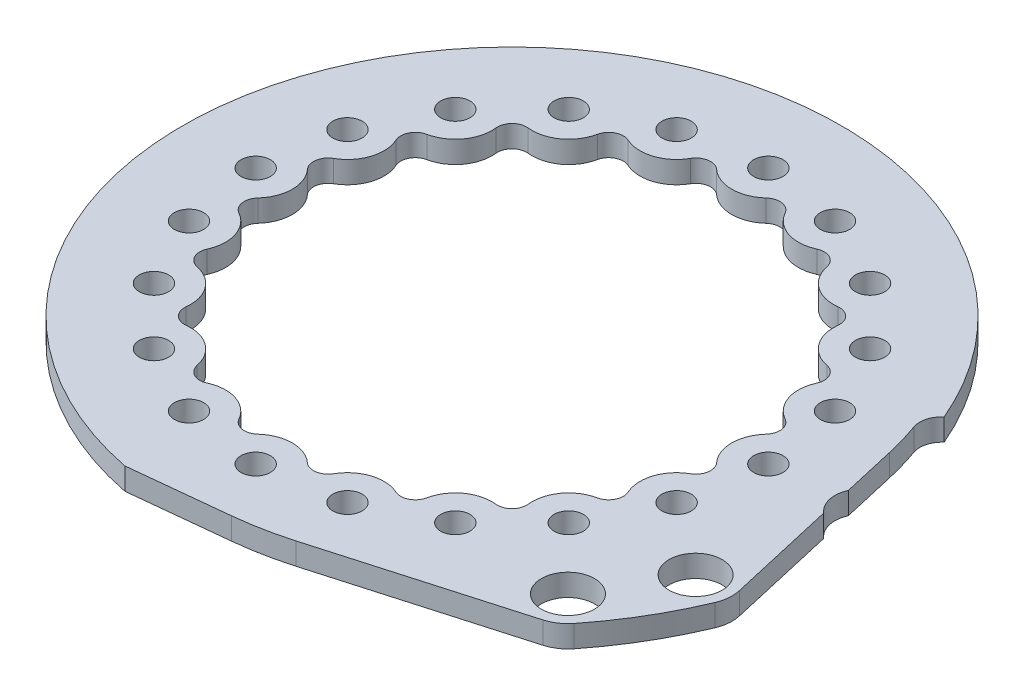
from build123d import *

# Parameters (mm, degrees)
SKETCH1_R           = 103.5
SKETCH1_R_2         = 60
BOSS_EXTRUDE1_DEPTH = 6
SKETCH2_R           = 4
CUT_EXTRUDE1_DEPTH  = 147.494027182
CIRPATTERN1_COUNT   = 20
SKETCH3_R           = 7.25
CUT_EXTRUDE2_DEPTH  = 6
SKETCH4_OUTSIDE_W   = 267.56
SKETCH4_OUTSIDE_H   = 267.56
CUT_EXTRUDE3_DEPTH  = 147.494027182
CUT_EXTRUDE4_DEPTH  = 10
BOSS_EXTRUDE2_START = -6
BOSS_EXTRUDE2_DEPTH = 6
FILLET1_R           = 6
SKETCH7_R           = 7.5
CUT_EXTRUDE5_DEPTH  = 10


with BuildPart() as part:
    # Sketch1 → Boss-Extrude1 (new body)
    with BuildSketch(Plane(origin=(0, 0, 0), x_dir=(1, 0, 0), z_dir=(0, 1, 0))):
        with Locations(Location((0, 0, 0), (0, 0, 270))):
            Circle(SKETCH1_R)
        with Locations(Location((0, 0, 0), (0, 0, 270))):
            Circle(SKETCH1_R_2, mode=Mode.SUBTRACT)
    extrude(amount=BOSS_EXTRUDE1_DEPTH)

    # Sketch2 → Cut-Extrude1 (cut, through all)
    with BuildSketch(Plane(origin=(0, 6, 0), x_dir=(1, 0, 0), z_dir=(0, 1, 0))):
        with Locations(Location((0, 70, 0), (0, 0, 270))):
            Circle(SKETCH2_R)
    cut_extrude1 = extrude(amount=-CUT_EXTRUDE1_DEPTH, mode=Mode.SUBTRACT)

    # CirPattern1: Cut-Extrude1 ×20 about axis
    cirpattern1_axis = Axis((0, 0, 0), (0, 1, 0))
    for i in range(1, CIRPATTERN1_COUNT):
        add(cut_extrude1.rotate(cirpattern1_axis, i * 360 / CIRPATTERN1_COUNT), mode=Mode.SUBTRACT)

    # Sketch3 → Cut-Extrude2 (cut)
    with BuildSketch(Plane(origin=(0, 6, 0), x_dir=(1, 0, 0), z_dir=(0, 1, 0))):
        with Locations(Location((86.266964059, -36.13705179, 0), (0, 0, 270))):
            Circle(SKETCH3_R)
        with Locations(Location((73.328010939, -58.059266372, 0), (0, 0, 270))):
            Circle(SKETCH3_R)
    extrude(amount=-CUT_EXTRUDE2_DEPTH, mode=Mode.SUBTRACT)

    # Sketch4 outside → Cut-Extrude3 (cut, through all)
    with BuildSketch(Plane(origin=(0, 6, 0), x_dir=(1, 0, 0), z_dir=(0, 1, 0))):
        Rectangle(SKETCH4_OUTSIDE_W, SKETCH4_OUTSIDE_H)
        with BuildLine():
            Line((23.716937817, -82.665028038), (76.077499384, -67.64256676))
            ThreePointArc((76.077499384, -67.64256676), (78.876917409, -66.342319555), (81.144475094, -64.248145201))
            ThreePointArc((81.144475094, -64.248145201), (89.13274289, -52.60802358), (95.46266736, -39.989112774))
            ThreePointArc((95.46266736, -39.989112774), (96.200172038, -36.991868886), (95.985582928, -33.91269114))
            Line((95.985582928, -33.91269114), (83.832277903, 19.187214014))
            ThreePointArc((83.832277903, 19.187214014), (-74.061989261, 43.712947129), (23.716937817, -82.665028038))
        make_face(mode=Mode.SUBTRACT)
    extrude(amount=-CUT_EXTRUDE3_DEPTH, mode=Mode.SUBTRACT)

    # Sketch5 → Cut-Extrude4 (cut)
    with BuildSketch(Plane(origin=(0, 6, 0), x_dir=(1, 0, 0), z_dir=(0, 1, 0))):
        with BuildLine():
            ThreePointArc((46.694681279, 42.270046437), (48.541019662, 35.267115138), (54.63065317, 31.347118204))
            ThreePointArc((54.63065317, 31.347118204), (57.394464692, 29.243940421), (57.471443608, 25.771753046))
            ThreePointArc((57.471443608, 25.771753046), (57.063390978, 18.541019662), (61.643630936, 12.931080792))
            ThreePointArc((61.643630936, 12.931080792), (63.622254217, 10.076775126), (62.622500611, 6.750740904))
            ThreePointArc((62.622500611, 6.750740904), (60, 0), (62.622500611, -6.750740904))
            ThreePointArc((62.622500611, -6.750740904), (63.622254217, -10.076775126), (61.643630936, -12.931080792))
            ThreePointArc((61.643630936, -12.931080792), (57.063390978, -18.541019662), (57.471443608, -25.771753046))
            ThreePointArc((57.471443608, -25.771753046), (57.394464692, -29.243940421), (54.63065317, -31.347118204))
            ThreePointArc((54.63065317, -31.347118204), (48.541019662, -35.267115138), (46.694681279, -42.270046437))
            ThreePointArc((46.694681279, -42.270046437), (45.548505072, -45.548505072), (42.270046437, -46.694681279))
            ThreePointArc((42.270046437, -46.694681279), (35.267115138, -48.541019662), (31.347118204, -54.63065317))
            ThreePointArc((31.347118204, -54.63065317), (29.243940421, -57.394464692), (25.771753046, -57.471443608))
            ThreePointArc((25.771753046, -57.471443608), (18.541019662, -57.063390978), (12.931080792, -61.643630936))
            ThreePointArc((12.931080792, -61.643630936), (10.076775126, -63.622254217), (6.750740904, -62.622500611))
            ThreePointArc((6.750740904, -62.622500611), (0, -60), (-6.750740904, -62.622500611))
            ThreePointArc((-6.750740904, -62.622500611), (-10.076775126, -63.622254217), (-12.931080792, -61.643630936))
            ThreePointArc((-12.931080792, -61.643630936), (-18.541019662, -57.063390978), (-25.771753046, -57.471443608))
            ThreePointArc((-25.771753046, -57.471443608), (-29.243940421, -57.394464692), (-31.347118204, -54.63065317))
            ThreePointArc((-31.347118204, -54.63065317), (-35.267115138, -48.541019662), (-42.270046437, -46.694681279))
            ThreePointArc((-42.270046437, -46.694681279), (-45.548505072, -45.548505072), (-46.694681279, -42.270046437))
            ThreePointArc((-46.694681279, -42.270046437), (-48.541019662, -35.267115138), (-54.63065317, -31.347118204))
            ThreePointArc((-54.63065317, -31.347118204), (-57.394464692, -29.243940421), (-57.471443608, -25.771753046))
            ThreePointArc((-57.471443608, -25.771753046), (-57.063390978, -18.541019662), (-61.643630936, -12.931080792))
            ThreePointArc((-61.643630936, -12.931080792), (-63.622254217, -10.076775126), (-62.622500611, -6.750740904))
            ThreePointArc((-62.622500611, -6.750740904), (-60, 0), (-62.622500611, 6.750740904))
            ThreePointArc((-62.622500611, 6.750740904), (-63.622254217, 10.076775126), (-61.643630936, 12.931080792))
            ThreePointArc((-61.643630936, 12.931080792), (-57.063390978, 18.541019662), (-57.471443608, 25.771753046))
            ThreePointArc((-57.471443608, 25.771753046), (-57.394464692, 29.243940421), (-54.63065317, 31.347118204))
            ThreePointArc((-54.63065317, 31.347118204), (-48.541019662, 35.267115138), (-46.694681279, 42.270046437))
            ThreePointArc((-46.694681279, 42.270046437), (-45.548505072, 45.548505072), (-42.270046437, 46.694681279))
            ThreePointArc((-42.270046437, 46.694681279), (-35.267115138, 48.541019662), (-31.347118204, 54.63065317))
            ThreePointArc((-31.347118204, 54.63065317), (-29.243940421, 57.394464692), (-25.771753046, 57.471443608))
            ThreePointArc((-25.771753046, 57.471443608), (-18.541019662, 57.063390978), (-12.931080792, 61.643630936))
            ThreePointArc((-12.931080792, 61.643630936), (-10.076775126, 63.622254217), (-6.750740904, 62.622500611))
            ThreePointArc((-6.750740904, 62.622500611), (0, 60), (6.750740904, 62.622500611))
            ThreePointArc((6.750740904, 62.622500611), (10.076775126, 63.622254217), (12.931080792, 61.643630936))
            ThreePointArc((12.931080792, 61.643630936), (18.541019662, 57.063390978), (25.771753046, 57.471443608))
            ThreePointArc((25.771753046, 57.471443608), (29.243940421, 57.394464692), (31.347118204, 54.63065317))
            ThreePointArc((31.347118204, 54.63065317), (35.267115138, 48.541019662), (42.270046437, 46.694681279))
            ThreePointArc((42.270046437, 46.694681279), (45.548505072, 45.548505072), (46.694681279, 42.270046437))
        make_face()
    extrude(amount=-CUT_EXTRUDE4_DEPTH, mode=Mode.SUBTRACT)

    # Sketch6 → Boss-Extrude2 (add)
    with BuildSketch(Plane.XZ.offset(BOSS_EXTRUDE2_START)):
        with BuildLine():
            Line((8.989447841, 85.528883002), (-17.398199941, 88.302336542))
            ThreePointArc((-17.398199941, 88.302336542), (-69.870812829, -56.728031119), (82.845436811, -35.165801564))
            Line((82.845436811, -35.165801564), (79.163417397, -33.60287705))
            ThreePointArc((79.163417397, -33.60287705), (-74.100107798, -43.648299215), (8.989447841, 85.528883002))
        make_face()
    extrude(amount=BOSS_EXTRUDE2_DEPTH)

    # Fillet1
    # the kernel refuses this fillet: 6 mm, written as the material it adds along each edge
    with BuildSketch(Plane(origin=(79.163417397, 6, -33.60287705), x_dir=(0.3619298171455144, 0, 0.9322053461877455), z_dir=(0, -1, 0))) as fillet1_piece_1:
        with BuildLine():
            CenterArc((5.532861862, -5.997100749), FILLET1_R, 91.781239909, 68.757327573)
            Line((-0.124333974, -3.998067166), (-0.237477891, -3.958086494))
            ThreePointArc((-0.237477891, -3.958086494), (-0.182109002, -1.995303564), (-0.119942015, 0.003730019))
            Line((-0.119942015, 0.003730019), (0.003730019, 0.119942015))
            ThreePointArc((0.003730019, 0.119942015), (2.67318045, 0.078444066), (5.342630881, 0.119942015))
            Line((5.342630881, 0.119942015), (5.346360901, 0))
        make_face()
    extrude(amount=6)

    # Sketch7 → Cut-Extrude5 (cut)
    with BuildSketch(Plane.XZ):
        with Locations((94.002430013, -1.686361811)):
            Circle(SKETCH7_R)
    extrude(amount=-CUT_EXTRUDE5_DEPTH, mode=Mode.SUBTRACT)


solid = part.part
